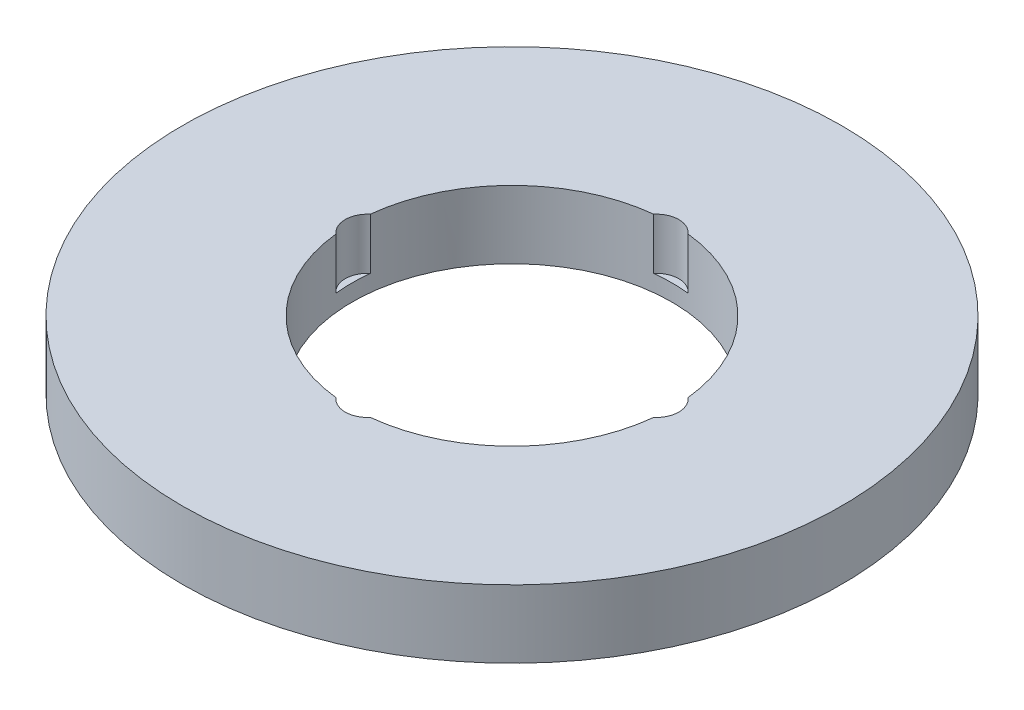
from build123d import *

# Parameters (mm, degrees)
SKETCH1_R           = 82.5
BOSS_EXTRUDE1_DEPTH = 17
SKETCH2_R           = 40
CUT_EXTRUDE1_DEPTH  = 118.904622471
SKETCH3_R           = 5.652492576
CUT_EXTRUDE2_DEPTH  = 12.839244405
CIRPATTERN1_COUNT   = 4


with BuildPart() as part:
    # Sketch1 → Boss-Extrude1 (new body)
    with BuildSketch(Plane(origin=(0, 0, 0), x_dir=(1, 0, 0), z_dir=(0, 1, 0))):
        Circle(SKETCH1_R)
    extrude(amount=BOSS_EXTRUDE1_DEPTH)

    # Sketch2 → Cut-Extrude1 (cut, through all)
    with BuildSketch(Plane(origin=(0, 0, 0), x_dir=(1, 0, 0), z_dir=(0, 1, 0))):
        Circle(SKETCH2_R)
    extrude(amount=CUT_EXTRUDE1_DEPTH, mode=Mode.SUBTRACT)

    # Sketch3 → Cut-Extrude2 (cut)
    with BuildSketch(Plane(origin=(0, 17, 0), x_dir=(1, 0, 0), z_dir=(0, 1, 0))):
        with Locations((-36.098285333, 0)):
            Circle(SKETCH3_R)
    cut_extrude2 = extrude(amount=-CUT_EXTRUDE2_DEPTH, mode=Mode.SUBTRACT)

    # CirPattern1: Cut-Extrude2 ×4 about axis
    cirpattern1_axis = Axis((0, 0, 0), (0, 1, 0))
    for i in range(1, CIRPATTERN1_COUNT):
        add(cut_extrude2.rotate(cirpattern1_axis, i * 360 / CIRPATTERN1_COUNT), mode=Mode.SUBTRACT)


solid = part.part
